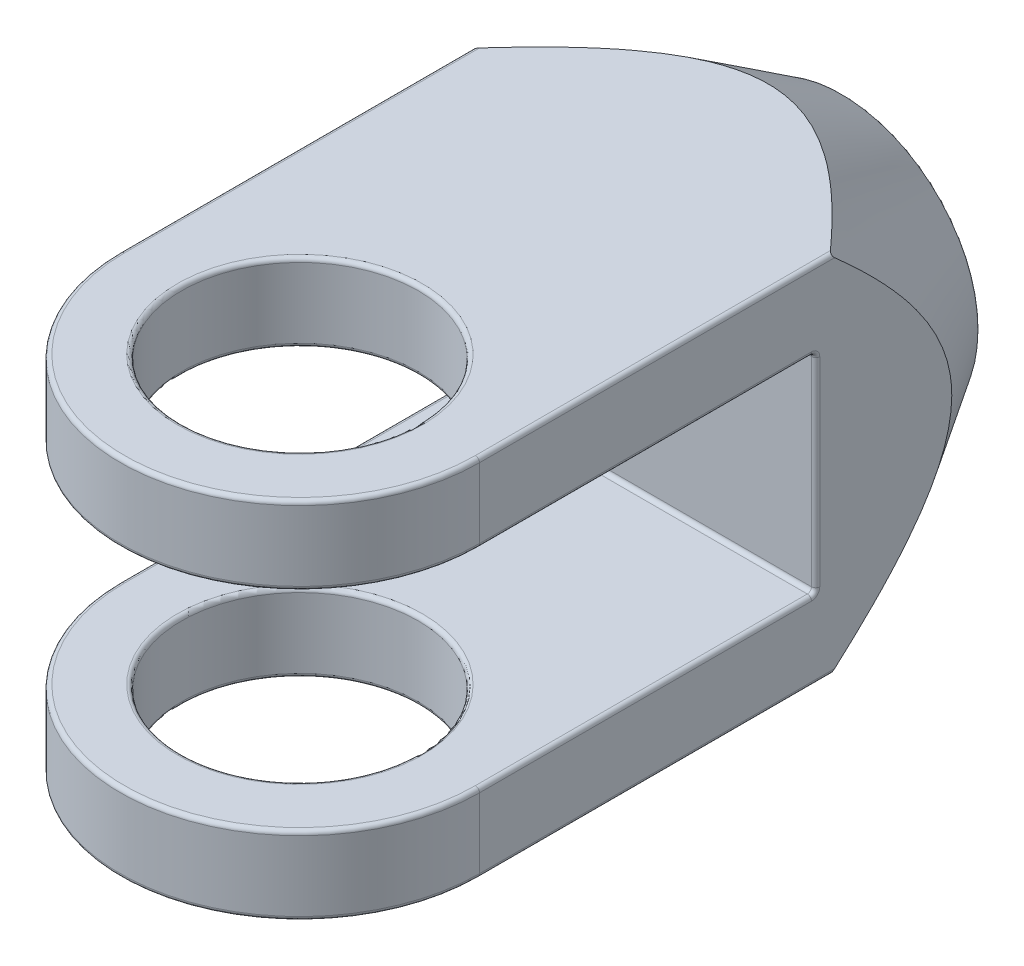
from build123d import *

# Parameters (mm, degrees)
SKETCH1_R                   = 7.239
BOSS_EXTRUDE1_DEPTH         = 22.2758
SKETCH2_W                   = 31.5468
SKETCH2_H                   = 12.7
CUT_EXTRUDE1_DEPTH          = 12.7
FILLET1_R                   = 0.254
FILLET2_R                   = 0.254
FILLET3_R                   = 0.254
FILLET4_R                   = 0.254
FILLET5_R                   = 0.254
F_1_4_20_TAPPED_HOLE1_D     = 5.1054
F_1_4_20_TAPPED_HOLE1_DEPTH = 16.51
F_1_4_20_TAPPED_HOLE1_TIP   = 1.533816902


with BuildPart() as part:
    # Sketch1 → Boss-Extrude1 (new body)
    with BuildSketch(Plane(origin=(0, 0, 0), x_dir=(1, 0, 0), z_dir=(0, 1, 0))):
        with BuildLine():
            Line((-10.9855, 0), (-10.9855, 33.2613))
            Line((-10.9855, 33.2613), (10.9855, 33.2613))
            Line((10.9855, 33.2613), (10.9855, 0))
            ThreePointArc((10.9855, 0), (0, -10.9855), (-10.9855, 0))
        make_face()
        with Locations(Location((0, 0, 0), (0, 0, 270))):
            Circle(SKETCH1_R, mode=Mode.SUBTRACT)
    extrude(amount=BOSS_EXTRUDE1_DEPTH)

    # Sketch2 → Cut-Extrude1 (cut, symmetric)
    with BuildSketch(Plane(origin=(0, 0, 0), x_dir=(0, 0, -1), z_dir=(1, 0, 0))):
        with Locations((4.7879, 11.1379)):
            Rectangle(SKETCH2_W, SKETCH2_H)
    extrude(amount=CUT_EXTRUDE1_DEPTH, both=True, mode=Mode.SUBTRACT)

    # Sketch5 → Cut-Revolve1 (revolve, cut)
    with BuildSketch(Plane(origin=(5.568421495, 5.492228727, 0), x_dir=(0, 0, 1), z_dir=(-0.7119608885898049, -0.7022191204449046, 0)), mode=Mode.PRIVATE) as cut_revolve1_sk:
        Polygon((-21.436464447, 23.57372651), (-33.2613, 16.184749181), (-33.2613, 23.57372651), align=None)
    revolve(cut_revolve1_sk.sketch.rotate(Axis((0, 11.1379, -33.2613), (0, 0, 1)), 270.789356568), axis=Axis((0, 11.1379, -33.2613), (0, 0, 1)), mode=Mode.SUBTRACT)

    # Fillet1
    fillet1_edges = [part.edges().sort_by_distance(p)[0] for p in [
        (0, 17.4879, -20.5613),
        (0, 4.7879, -20.5613),
    ]]
    fillet(fillet1_edges, radius=FILLET1_R)

    # Fillet2
    fillet2_edges = [part.edges().sort_by_distance(p)[0] for p in [
        (0, 17.4879, 10.9855),
        (10.9855, 17.4879, -10.15365),
        (0, 4.7879, 10.9855),
        (-10.9855, 4.7879, -10.15365),
        (-10.9855, 11.1379, -20.5613),
        (10.9855, 11.1379, -20.5613),
        (10.9855, 4.7879, -10.15365),
        (-10.9855, 17.4879, -10.15365),
        (10.9855, 4.862294878, -20.486905122),
        (-10.9855, 4.862294878, -20.486905122),
        (10.9855, 17.413505122, -20.486905122),
        (-10.9855, 17.413505122, -20.486905122),
    ]]
    fillet(fillet2_edges, radius=FILLET2_R)

    # Fillet3
    # the kernel refuses this fillet: 0.254 mm, written as the material it takes off along each edge
    with BuildSketch(Plane(origin=(-10.9855, 22.2758, 0), x_dir=(0, -1, 0), z_dir=(0, 0, -1)), Plane(origin=(10.9855, 0, -22.071464447), x_dir=(-1, 0, 0), z_dir=(0, 0, 1))) as fillet3_piece_1:
        with BuildLine():
            CenterArc((FILLET3_R, -FILLET3_R), FILLET3_R, 90, 90)
            Line((0, -FILLET3_R), (0, 0))
            Line((0, 0), (FILLET3_R, 0))
        make_face()
    extrude(amount=22.071464447, mode=Mode.SUBTRACT)
    with BuildSketch(Plane(origin=(0, 22.2758, 0), x_dir=(1, 0, 0), z_dir=(0, 0, -1))) as fillet3_piece_2:
        with BuildLine():
            CenterArc((10.9855 - FILLET3_R, FILLET3_R), FILLET3_R, 270, 90)
            Line((10.9855 - FILLET3_R, 0), (10.9855, 0))
            Line((10.9855, 0), (10.9855, FILLET3_R))
        make_face()
    revolve(axis=Axis((0, 22.2758, 0), (0, -1, 0)), revolution_arc=180, mode=Mode.SUBTRACT)
    with BuildSketch(Plane(origin=(10.9855, 22.2758, -22.071464447), x_dir=(-1, 0, 0), z_dir=(0, 0, 1)), Plane(origin=(-10.9855, 0, 0), x_dir=(0, 1, 0), z_dir=(0, 0, -1))) as fillet3_piece_3:
        with BuildLine():
            CenterArc((FILLET3_R, FILLET3_R), FILLET3_R, 180, 90)
            Line((0, FILLET3_R), (0, 0))
            Line((0, 0), (FILLET3_R, 0))
        make_face()
    extrude(amount=22.071464447, mode=Mode.SUBTRACT)
    with BuildSketch(Plane(origin=(0, 0, 0), x_dir=(1, 0, 0), z_dir=(0, 0, -1))) as fillet3_piece_4:
        with BuildLine():
            CenterArc((10.9855 - FILLET3_R, -FILLET3_R), FILLET3_R, 0, 90)
            Line((10.9855, -FILLET3_R), (10.9855, 0))
            Line((10.9855, 0), (10.9855 - FILLET3_R, 0))
        make_face()
    revolve(axis=Axis((0, 0, 0), (0, -1, 0)), revolution_arc=180, mode=Mode.SUBTRACT)

    # Fillet4
    fillet4_edges = [part.edges().sort_by_distance(p)[0] for p in [
        (0, 0, -7.239),
        (0, 22.2758, -7.239),
        (0, 17.4879, -7.239),
        (0, 4.7879, -7.239),
    ]]
    fillet(fillet4_edges, radius=FILLET4_R)

    # Fillet5
    fillet5_edges = [part.edges().sort_by_distance(p)[0] for p in [
        (-5.796819888, 5.260663899, -33.2613),
    ]]
    fillet(fillet5_edges, radius=FILLET5_R)

    # 1/4-20 Tapped Hole1
    with Locations(Plane(origin=(0, 0, -33.2613), x_dir=(-1, 0, 0), z_dir=(0, 0, -1))):
        with Locations((-0.1905, 11.176)):
            Hole(F_1_4_20_TAPPED_HOLE1_D / 2, depth=F_1_4_20_TAPPED_HOLE1_DEPTH)
            with Locations((0, 0, -(F_1_4_20_TAPPED_HOLE1_DEPTH + F_1_4_20_TAPPED_HOLE1_TIP / 2))):  # 118° drill point
                Cone(0, F_1_4_20_TAPPED_HOLE1_D / 2, F_1_4_20_TAPPED_HOLE1_TIP, mode=Mode.SUBTRACT)


solid = part.part
